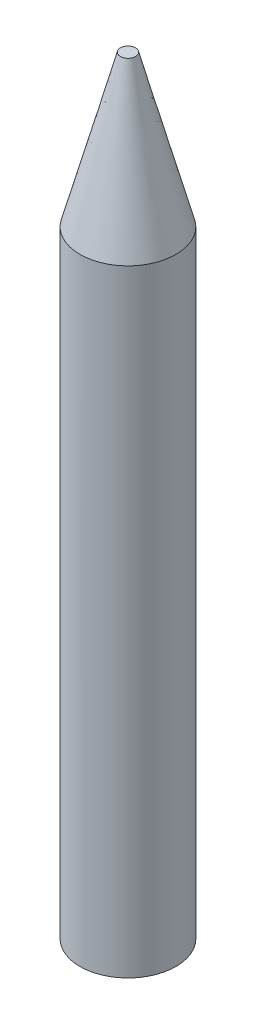
from build123d import *

# Parameters (mm, degrees)
SKETCH1_R           = 3.175
BOSS_EXTRUDE1_DEPTH = 40.8


with BuildPart() as part:
    # Sketch1 → Boss-Extrude1 (new body)
    with BuildSketch(Plane(origin=(0, 0, 0), x_dir=(1, 0, 0), z_dir=(0, 1, 0))):
        with Locations(Location((0, 0, 0), (0, 0, 270))):
            Circle(SKETCH1_R)
    extrude(amount=BOSS_EXTRUDE1_DEPTH)

    # Loft1: read off the stored shape, not the designer's step
    # Loft1: loft between two sections, ruled curve by curve
    loft1_from = [
        Edge.make_bspline([(1.168795455, 40.8, 2.952040343), (7.07287614, 40.8, 0.614449433), (4.735285231, 40.8, -5.289631252), (-1.168795455, 40.8, -2.952040343), (-7.07287614, 40.8, -0.614449433), (-4.735285231, 40.8, 5.289631252), (1.168795455, 40.8, 2.952040343)], [0, 0, 0, 0, 0.5, 0.5, 0.5, 1, 1, 1, 1], 3, [1, 0.333333333, 0.333333333, 1, 0.333333333, 0.333333333, 1]),
    ]
    loft1_to = [
        Edge.make_bspline([(0.07945815, 50.8, 0.493646029), (1.066750209, 50.8, 0.33472973), (0.907833909, 50.8, -0.652562329), (-0.07945815, 50.8, -0.493646029), (-1.066750209, 50.8, -0.33472973), (-0.907833909, 50.8, 0.652562329), (0.07945815, 50.8, 0.493646029)], [0, 0, 0, 0, 0.5, 0.5, 0.5, 1, 1, 1, 1], 3, [1, 0.333333333, 0.333333333, 1, 0.333333333, 0.333333333, 1]),
    ]
    loft1 = Solid(Shell([*[Face.make_surface_from_curves(loft1_from[k], loft1_to[k]) for k in range(1)], Face(Wire(loft1_from)), Face(Wire(loft1_to))]))
    add(loft1)


solid = part.part
